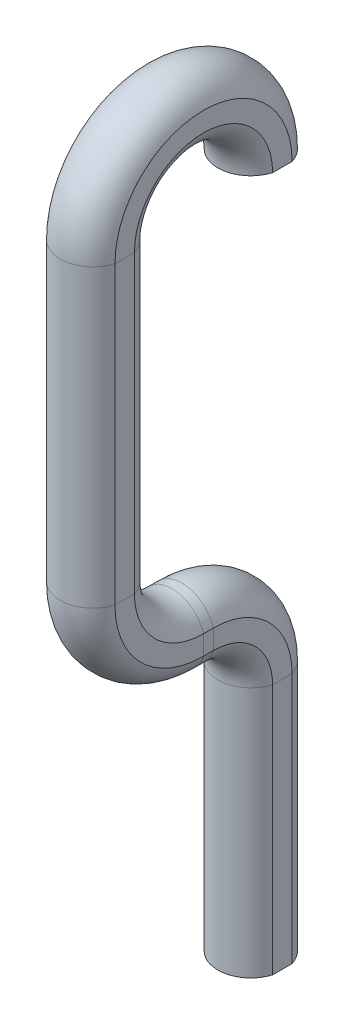
from build123d import *


with BuildPart() as part:
    # Sweep1: sweep along a path in Sketch1
    with BuildLine(Plane.YZ) as sweep1_path:
        Line((0, 0), (64.77, 0))
        ThreePointArc((64.77, 0), (77.342358569, 5.207641431), (82.55, 17.78))
        Line((82.55, 17.78), (82.55, 20.32))
        ThreePointArc((82.55, 20.32), (88.501590206, 34.688409794), (102.87, 40.64))
        Line((102.87, 40.64), (179.07, 40.64))
        ThreePointArc((179.07, 40.64), (199.39, 20.32), (179.07, 0))
    # Sketch2 → Sweep1 (sweep)
    with BuildSketch(Plane(origin=(0, 0, 0), x_dir=(-1, 0, 0), z_dir=(0, 1, 0))):
        with BuildLine():
            Line((-8.128, 2.5146), (-8.128, -2.5146))
            ThreePointArc((-8.128, -2.5146), (0, -8.505923095), (8.128, -2.5146))
            Line((8.128, -2.5146), (8.128, 2.5146))
            ThreePointArc((8.128, 2.5146), (0, 8.505923095), (-8.128, 2.5146))
        make_face()
    sweep(path=sweep1_path.line)


solid = part.part
